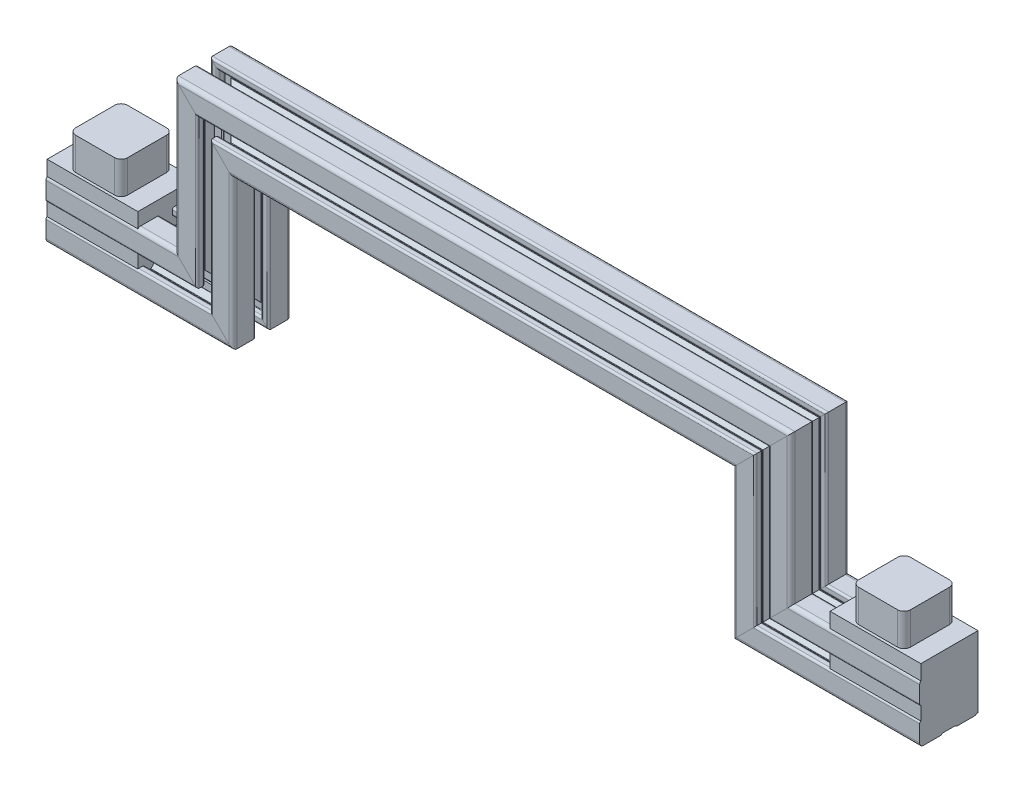
from build123d import *

# Parameters (mm, degrees)
SKETCH6_W            = 44.121320344
SKETCH6_H            = 54.791290411
BOSS_EXTRUDE3_DEPTH  = 70
SKETCH4_W            = 40
SKETCH4_H            = 40
RL_WHEEL_MOUNT_DEPTH = 25
FILLET1_R            = 5
FILLET1_OF_MIRROR1_R = 5


with BuildPart() as part:
    # Sweep1: sweep along a path in Sketch1
    with BuildLine(Plane.XY) as sweep1_path:
        Line((0, 0), (125, 0))
        Line((125, 0), (125, 115.07066992))
        Line((125, 115.07066992), (337, 115.07066992))
    # Sketch7 → Sweep1 (sweep)
    with BuildSketch(Plane(origin=(0, 0, 0), x_dir=(0, 0, -1), z_dir=(1, 0, 0))):
        with BuildLine():
            Line((4.905816029, 11.21531926), (4.005816103, 10.700171216))
            Line((4.005816103, 10.700171216), (3.105816176, 11.21531926))
            Line((3.105816176, 11.21531926), (-2.197508215, 11.21531926))
            ThreePointArc((-2.197508215, 11.21531926), (-2.342927919, 11.244245037), (-2.466208792, 11.326618683))
            Line((-2.466208792, 11.326618683), (-5.932884474, 14.793294365))
            ThreePointArc((-5.932884474, 14.793294365), (-6.01525812, 14.916575238), (-6.044183897, 15.061994942))
            Line((-6.044183897, 15.061994942), (-6.044183897, 19.35531926))
            ThreePointArc((-6.044183897, 19.35531926), (-5.932884474, 19.624019836), (-5.664183897, 19.73531926))
            Line((-5.664183897, 19.73531926), (-2.579183897, 19.73531926))
            ThreePointArc((-2.579183897, 19.73531926), (-1.50438159, 20.180516952), (-1.059183897, 21.25531926))
            Line((-1.059183897, 21.25531926), (-1.059183897, 24.21531926))
            ThreePointArc((-1.059183897, 24.21531926), (-1.50438159, 25.290121567), (-2.579183897, 25.73531926))
            Line((-2.579183897, 25.73531926), (-15.494183897, 25.73531926))
            ThreePointArc((-15.494183897, 25.73531926), (-17.615504241, 24.856639603), (-18.494183897, 22.73531926))
            Line((-18.494183897, 22.73531926), (-18.494183897, 9.82031926))
            ThreePointArc((-18.494183897, 9.82031926), (-18.048986205, 8.745516952), (-16.974183897, 8.30031926))
            Line((-16.974183897, 8.30031926), (-14.014183897, 8.30031926))
            ThreePointArc((-14.014183897, 8.30031926), (-12.93938159, 8.745516952), (-12.494183897, 9.82031926))
            Line((-12.494183897, 9.82031926), (-12.494183897, 12.90531926))
            ThreePointArc((-12.494183897, 12.90531926), (-12.382884474, 13.174019836), (-12.114183897, 13.28531926))
            Line((-12.114183897, 13.28531926), (-7.813788512, 13.28531926))
            ThreePointArc((-7.813788512, 13.28531926), (-7.668368808, 13.256393482), (-7.545087935, 13.174019836))
            Line((-7.545087935, 13.174019836), (-4.08548332, 9.714415222))
            ThreePointArc((-4.08548332, 9.714415222), (-4.003109675, 9.591134349), (-3.974183897, 9.445714645))
            Line((-3.974183897, 9.445714645), (-3.974183897, 4.135318895))
            Line((-3.974183897, 4.135318895), (-3.454570628, 3.23531926))
            Line((-3.454570628, 3.23531926), (-3.974183897, 2.335319624))
            Line((-3.974183897, 2.335319624), (-3.974183897, -2.968005058))
            ThreePointArc((-3.974183897, -2.968005058), (-4.003109675, -3.113424762), (-4.08548332, -3.236705635))
            Line((-4.08548332, -3.236705635), (-7.552159003, -6.703381317))
            ThreePointArc((-7.552159003, -6.703381317), (-7.675439876, -6.785754963), (-7.82085958, -6.81468074))
            Line((-7.82085958, -6.81468074), (-12.114183897, -6.81468074))
            ThreePointArc((-12.114183897, -6.81468074), (-12.382884474, -6.703381317), (-12.494183897, -6.43468074))
            Line((-12.494183897, -6.43468074), (-12.494183897, -3.34968074))
            ThreePointArc((-12.494183897, -3.34968074), (-12.93938159, -2.274878433), (-14.014183897, -1.82968074))
            Line((-14.014183897, -1.82968074), (-16.974183897, -1.82968074))
            ThreePointArc((-16.974183897, -1.82968074), (-18.048986205, -2.274878433), (-18.494183897, -3.34968074))
            Line((-18.494183897, -3.34968074), (-18.494183897, -16.26468074))
            ThreePointArc((-18.494183897, -16.26468074), (-17.615504241, -18.386001084), (-15.494183897, -19.26468074))
            Line((-15.494183897, -19.26468074), (-2.579183897, -19.26468074))
            ThreePointArc((-2.579183897, -19.26468074), (-1.50438159, -18.819483048), (-1.059183897, -17.74468074))
            Line((-1.059183897, -17.74468074), (-1.059183897, -14.78468074))
            ThreePointArc((-1.059183897, -14.78468074), (-1.50438159, -13.709878433), (-2.579183897, -13.26468074))
            Line((-2.579183897, -13.26468074), (-5.664183897, -13.26468074))
            ThreePointArc((-5.664183897, -13.26468074), (-5.932884474, -13.153381317), (-6.044183897, -12.88468074))
            Line((-6.044183897, -12.88468074), (-6.044183897, -8.584285355))
            ThreePointArc((-6.044183897, -8.584285355), (-6.01525812, -8.438865651), (-5.932884474, -8.315584778))
            Line((-5.932884474, -8.315584778), (-2.473279859, -4.855980164))
            ThreePointArc((-2.473279859, -4.855980164), (-2.349998987, -4.773606518), (-2.204579283, -4.74468074))
            Line((-2.204579283, -4.74468074), (3.105816176, -4.74468074))
            Line((3.105816176, -4.74468074), (4.005816103, -4.229532697))
            Line((4.005816103, -4.229532697), (4.905816029, -4.74468074))
            Line((4.905816029, -4.74468074), (10.20914042, -4.74468074))
            ThreePointArc((10.20914042, -4.74468074), (10.354560124, -4.773606518), (10.477840997, -4.855980164))
            Line((10.477840997, -4.855980164), (13.94451668, -8.322655846))
            ThreePointArc((13.94451668, -8.322655846), (14.026890325, -8.445936719), (14.055816103, -8.591356423))
            Line((14.055816103, -8.591356423), (14.055816103, -12.88468074))
            ThreePointArc((14.055816103, -12.88468074), (13.94451668, -13.153381317), (13.675816103, -13.26468074))
            Line((13.675816103, -13.26468074), (10.590816103, -13.26468074))
            ThreePointArc((10.590816103, -13.26468074), (9.516013795, -13.709878433), (9.070816103, -14.78468074))
            Line((9.070816103, -14.78468074), (9.070816103, -17.74468074))
            ThreePointArc((9.070816103, -17.74468074), (9.516013795, -18.819483048), (10.590816103, -19.26468074))
            Line((10.590816103, -19.26468074), (23.505816103, -19.26468074))
            ThreePointArc((23.505816103, -19.26468074), (25.627136446, -18.386001084), (26.505816103, -16.26468074))
            Line((26.505816103, -16.26468074), (26.505816103, -3.34968074))
            ThreePointArc((26.505816103, -3.34968074), (26.06061841, -2.274878433), (24.985816103, -1.82968074))
            Line((24.985816103, -1.82968074), (22.025816103, -1.82968074))
            ThreePointArc((22.025816103, -1.82968074), (20.951013795, -2.274878433), (20.505816103, -3.34968074))
            Line((20.505816103, -3.34968074), (20.505816103, -6.43468074))
            ThreePointArc((20.505816103, -6.43468074), (20.39451668, -6.703381317), (20.125816103, -6.81468074))
            Line((20.125816103, -6.81468074), (15.825420717, -6.81468074))
            ThreePointArc((15.825420717, -6.81468074), (15.680001013, -6.785754963), (15.556720141, -6.703381317))
            Line((15.556720141, -6.703381317), (12.097115526, -3.243776702))
            ThreePointArc((12.097115526, -3.243776702), (12.01474188, -3.12049583), (11.985816103, -2.975076126))
            Line((11.985816103, -2.975076126), (11.985816103, 2.335319624))
            Line((11.985816103, 2.335319624), (11.466202833, 3.23531926))
            Line((11.466202833, 3.23531926), (11.985816103, 4.135318895))
            Line((11.985816103, 4.135318895), (11.985816103, 9.438643577))
            ThreePointArc((11.985816103, 9.438643577), (12.01474188, 9.584063281), (12.097115526, 9.707344154))
            Line((12.097115526, 9.707344154), (15.563791208, 13.174019836))
            ThreePointArc((15.563791208, 13.174019836), (15.687072081, 13.256393482), (15.832491785, 13.28531926))
            Line((15.832491785, 13.28531926), (20.125816103, 13.28531926))
            ThreePointArc((20.125816103, 13.28531926), (20.39451668, 13.174019836), (20.505816103, 12.90531926))
            Line((20.505816103, 12.90531926), (20.505816103, 9.82031926))
            ThreePointArc((20.505816103, 9.82031926), (20.951013795, 8.745516952), (22.025816103, 8.30031926))
            Line((22.025816103, 8.30031926), (24.985816103, 8.30031926))
            ThreePointArc((24.985816103, 8.30031926), (26.06061841, 8.745516952), (26.505816103, 9.82031926))
            Line((26.505816103, 9.82031926), (26.505816103, 22.73531926))
            ThreePointArc((26.505816103, 22.73531926), (25.627136446, 24.856639603), (23.505816103, 25.73531926))
            Line((23.505816103, 25.73531926), (10.590816103, 25.73531926))
            ThreePointArc((10.590816103, 25.73531926), (9.516013795, 25.290121567), (9.070816103, 24.21531926))
            Line((9.070816103, 24.21531926), (9.070816103, 21.25531926))
            ThreePointArc((9.070816103, 21.25531926), (9.516013795, 20.180516952), (10.590816103, 19.73531926))
            Line((10.590816103, 19.73531926), (13.675816103, 19.73531926))
            ThreePointArc((13.675816103, 19.73531926), (13.94451668, 19.624019836), (14.055816103, 19.35531926))
            Line((14.055816103, 19.35531926), (14.055816103, 15.054923874))
            ThreePointArc((14.055816103, 15.054923874), (14.026890325, 14.90950417), (13.94451668, 14.786223298))
            Line((13.94451668, 14.786223298), (10.484912065, 11.326618683))
            ThreePointArc((10.484912065, 11.326618683), (10.361631192, 11.244245037), (10.216211488, 11.21531926))
            Line((10.216211488, 11.21531926), (4.905816029, 11.21531926))
        make_face()
        with BuildLine():
            Line((13.969837884, 21.274341041), (13.529837884, 21.274341041))
            ThreePointArc((13.529837884, 21.274341041), (12.469177713, 21.713680869), (12.029837884, 22.774341041))
            Line((12.029837884, 22.774341041), (12.029837884, 23.274341041))
            ThreePointArc((12.029837884, 23.274341041), (12.469177713, 24.335001213), (13.529837884, 24.774341041))
            Line((13.529837884, 24.774341041), (23.139837884, 24.774341041))
            ThreePointArc((23.139837884, 24.774341041), (24.752041345, 24.106544502), (25.419837884, 22.494341041))
            Line((25.419837884, 22.494341041), (25.419837884, 12.884341041))
            ThreePointArc((25.419837884, 12.884341041), (24.980498056, 11.823680869), (23.919837884, 11.384341041))
            Line((23.919837884, 11.384341041), (23.419837884, 11.384341041))
            ThreePointArc((23.419837884, 11.384341041), (22.359177713, 11.823680869), (21.919837884, 12.884341041))
            Line((21.919837884, 12.884341041), (21.919837884, 13.324341041))
            ThreePointArc((21.919837884, 13.324341041), (21.626944666, 14.031447822), (20.919837884, 14.324341041))
            Line((20.919837884, 14.324341041), (15.349837884, 14.324341041))
            ThreePointArc((15.349837884, 14.324341041), (15.081137307, 14.435640464), (14.969837884, 14.704341041))
            Line((14.969837884, 14.704341041), (14.969837884, 20.274341041))
            ThreePointArc((14.969837884, 20.274341041), (14.676944666, 20.981447822), (13.969837884, 21.274341041))
        make_face(mode=Mode.SUBTRACT)
        with BuildLine():
            Line((21.958859666, -6.68968074), (21.958859666, -6.24968074))
            ThreePointArc((21.958859666, -6.24968074), (22.398199494, -5.189020569), (23.458859666, -4.74968074))
            Line((23.458859666, -4.74968074), (23.958859666, -4.74968074))
            ThreePointArc((23.958859666, -4.74968074), (25.019519838, -5.189020569), (25.458859666, -6.24968074))
            Line((25.458859666, -6.24968074), (25.458859666, -15.85968074))
            ThreePointArc((25.458859666, -15.85968074), (24.791063127, -17.471884201), (23.178859666, -18.13968074))
            Line((23.178859666, -18.13968074), (13.568859666, -18.13968074))
            ThreePointArc((13.568859666, -18.13968074), (12.508199494, -17.700340912), (12.068859666, -16.63968074))
            Line((12.068859666, -16.63968074), (12.068859666, -16.13968074))
            ThreePointArc((12.068859666, -16.13968074), (12.508199494, -15.079020569), (13.568859666, -14.63968074))
            Line((13.568859666, -14.63968074), (14.008859666, -14.63968074))
            ThreePointArc((14.008859666, -14.63968074), (14.715966447, -14.346787522), (15.008859666, -13.63968074))
            Line((15.008859666, -13.63968074), (15.008859666, -8.06968074))
            ThreePointArc((15.008859666, -8.06968074), (15.120159089, -7.800980164), (15.388859666, -7.68968074))
            Line((15.388859666, -7.68968074), (20.958859666, -7.68968074))
            ThreePointArc((20.958859666, -7.68968074), (21.665966447, -7.396787522), (21.958859666, -6.68968074))
        make_face(mode=Mode.SUBTRACT)
        with BuildLine():
            Line((-6.005162116, -14.678702522), (-5.565162116, -14.678702522))
            ThreePointArc((-5.565162116, -14.678702522), (-4.504501944, -15.11804235), (-4.065162116, -16.178702522))
            Line((-4.065162116, -16.178702522), (-4.065162116, -16.678702522))
            ThreePointArc((-4.065162116, -16.678702522), (-4.504501944, -17.739362694), (-5.565162116, -18.178702522))
            Line((-5.565162116, -18.178702522), (-15.175162116, -18.178702522))
            ThreePointArc((-15.175162116, -18.178702522), (-16.787365577, -17.510905983), (-17.455162116, -15.898702522))
            Line((-17.455162116, -15.898702522), (-17.455162116, -6.288702522))
            ThreePointArc((-17.455162116, -6.288702522), (-17.015822287, -5.22804235), (-15.955162116, -4.788702522))
            Line((-15.955162116, -4.788702522), (-15.455162116, -4.788702522))
            ThreePointArc((-15.455162116, -4.788702522), (-14.394501944, -5.22804235), (-13.955162116, -6.288702522))
            Line((-13.955162116, -6.288702522), (-13.955162116, -6.728702522))
            ThreePointArc((-13.955162116, -6.728702522), (-13.662268897, -7.435809303), (-12.955162116, -7.728702522))
            Line((-12.955162116, -7.728702522), (-7.385162116, -7.728702522))
            ThreePointArc((-7.385162116, -7.728702522), (-7.116461539, -7.840001945), (-7.005162116, -8.108702522))
            Line((-7.005162116, -8.108702522), (-7.005162116, -13.678702522))
            ThreePointArc((-7.005162116, -13.678702522), (-6.712268897, -14.385809303), (-6.005162116, -14.678702522))
        make_face(mode=Mode.SUBTRACT)
        with BuildLine():
            Line((1.828915922, -2.488564034), (1.413170132, -2.316356489))
            ThreePointArc((1.413170132, -2.316356489), (0.823336155, -1.625307126), (1.036269925, -0.742067321))
            ThreePointArc((1.036269925, -0.742067321), (0.446703204, -0.237613869), (-0.057716637, 0.351981608))
            ThreePointArc((-0.057716637, 0.351981608), (-0.940937171, 0.139101897), (-1.631952253, 0.728927667))
            Line((-1.631952253, 0.728927667), (-1.804159798, 1.144673456))
            ThreePointArc((-1.804159798, 1.144673456), (-1.732589712, 2.050394753), (-0.957477943, 2.524372695))
            ThreePointArc((-0.957477943, 2.524372695), (-1.017662114, 3.297961778), (-0.957433843, 4.071547428))
            ThreePointArc((-0.957433843, 4.071547428), (-1.73249376, 4.54554997), (-1.804045409, 5.451241222))
            Line((-1.804045409, 5.451241222), (-1.631837865, 5.866987012))
            ThreePointArc((-1.631837865, 5.866987012), (-0.940788501, 6.456820989), (-0.057548696, 6.243887219))
            ThreePointArc((-0.057548696, 6.243887219), (0.446904755, 6.83345394), (1.036500233, 7.33787378))
            ThreePointArc((1.036500233, 7.33787378), (0.823620522, 8.221094315), (1.413446291, 8.912109397))
            Line((1.413446291, 8.912109397), (1.829192081, 9.084316942))
            ThreePointArc((1.829192081, 9.084316942), (2.734913377, 9.012746856), (3.20889132, 8.237635087))
            ThreePointArc((3.20889132, 8.237635087), (3.982480402, 8.297819258), (4.756066053, 8.237590987))
            ThreePointArc((4.756066053, 8.237590987), (5.230068594, 9.012650904), (6.135759847, 9.084202553))
            Line((6.135759847, 9.084202553), (6.551505636, 8.911995008))
            ThreePointArc((6.551505636, 8.911995008), (7.141339614, 8.220945645), (6.928405843, 7.33770584))
            ThreePointArc((6.928405843, 7.33770584), (7.517972564, 6.833252389), (8.022392405, 6.243656911))
            ThreePointArc((8.022392405, 6.243656911), (8.905612939, 6.456536622), (9.596628022, 5.866710852))
            Line((9.596628022, 5.866710852), (9.768835567, 5.450965063))
            ThreePointArc((9.768835567, 5.450965063), (9.697265481, 4.545243766), (8.922153712, 4.071265824))
            ThreePointArc((8.922153712, 4.071265824), (8.982337882, 3.297676741), (8.922109612, 2.524091091))
            ThreePointArc((8.922109612, 2.524091091), (9.697169528, 2.05008855), (9.768721178, 1.144397297))
            Line((9.768721178, 1.144397297), (9.596513633, 0.728651507))
            ThreePointArc((9.596513633, 0.728651507), (8.90546427, 0.13881753), (8.022224464, 0.351751301))
            ThreePointArc((8.022224464, 0.351751301), (7.517771013, -0.23781542), (6.928175536, -0.742235261))
            ThreePointArc((6.928175536, -0.742235261), (7.141055247, -1.625455795), (6.551229477, -2.316470878))
            Line((6.551229477, -2.316470878), (6.135483688, -2.488678423))
            ThreePointArc((6.135483688, -2.488678423), (5.229762391, -2.417108337), (4.755784449, -1.641996568))
            ThreePointArc((4.755784449, -1.641996568), (3.982195366, -1.702180738), (3.208609716, -1.641952468))
            ThreePointArc((3.208609716, -1.641952468), (2.734607174, -2.417012384), (1.828915922, -2.488564034))
        make_face(mode=Mode.SUBTRACT)
        with BuildLine():
            Line((-13.994183897, 13.28531926), (-13.994183897, 12.84531926))
            ThreePointArc((-13.994183897, 12.84531926), (-14.433523726, 11.784659088), (-15.494183897, 11.34531926))
            Line((-15.494183897, 11.34531926), (-15.994183897, 11.34531926))
            ThreePointArc((-15.994183897, 11.34531926), (-17.054844069, 11.784659088), (-17.494183897, 12.84531926))
            Line((-17.494183897, 12.84531926), (-17.494183897, 22.45531926))
            ThreePointArc((-17.494183897, 22.45531926), (-16.826387358, 24.067522721), (-15.214183897, 24.73531926))
            Line((-15.214183897, 24.73531926), (-5.604183897, 24.73531926))
            ThreePointArc((-5.604183897, 24.73531926), (-4.543523726, 24.295979431), (-4.104183897, 23.23531926))
            Line((-4.104183897, 23.23531926), (-4.104183897, 22.73531926))
            ThreePointArc((-4.104183897, 22.73531926), (-4.543523726, 21.674659088), (-5.604183897, 21.23531926))
            Line((-5.604183897, 21.23531926), (-6.044183897, 21.23531926))
            ThreePointArc((-6.044183897, 21.23531926), (-6.751290679, 20.942426041), (-7.044183897, 20.23531926))
            Line((-7.044183897, 20.23531926), (-7.044183897, 14.66531926))
            ThreePointArc((-7.044183897, 14.66531926), (-7.15548332, 14.396618683), (-7.424183897, 14.28531926))
            Line((-7.424183897, 14.28531926), (-12.994183897, 14.28531926))
            ThreePointArc((-12.994183897, 14.28531926), (-13.701290679, 13.992426041), (-13.994183897, 13.28531926))
        make_face(mode=Mode.SUBTRACT)
    sweep1 = sweep(path=sweep1_path.line, transition=Transition.RIGHT)

    # Sketch6 → Boss-Extrude3 (add)
    with BuildSketch(Plane.ZY):
        with Locations((-4.445155931, 9.009644122)):
            Rectangle(SKETCH6_W, SKETCH6_H)
    boss_extrude3 = extrude(amount=-BOSS_EXTRUDE3_DEPTH)

    # Sketch4 → RL Wheel Mount (add)
    with BuildSketch(Plane(origin=(0, 36.405289327, 0), x_dir=(1, 0, 0), z_dir=(0, 1, 0))):
        with Locations((35, 4.445155931)):
            Rectangle(SKETCH4_W, SKETCH4_H)
    rl_wheel_mount = extrude(amount=RL_WHEEL_MOUNT_DEPTH)

    # Fillet1
    fillet1_edges = [part.edges().sort_by_distance(p)[0] for p in [
        (15, 48.905289327, -24.445155931),
        (55, 48.905289327, -24.445155931),
        (55, 48.905289327, 15.554844069),
        (15, 48.905289327, 15.554844069),
    ]]
    fillet(fillet1_edges, radius=FILLET1_R)

    # Mirror1: Sweep1, Boss-Extrude3, RL Wheel Mount across plane
    add(sweep1.mirror(Plane(origin=(337, 0, 0), x_dir=(0, 0, 1), z_dir=(1, 0, 0))))
    add(boss_extrude3.mirror(Plane(origin=(337, 0, 0), x_dir=(0, 0, 1), z_dir=(1, 0, 0))))
    add(rl_wheel_mount.mirror(Plane(origin=(337, 0, 0), x_dir=(0, 0, 1), z_dir=(1, 0, 0))))

    # Fillet1 of Mirror1
    fillet1_of_mirror1_edges = [part.edges().sort_by_distance(p)[0] for p in [
        (659, 48.905289327, -24.445155931),
        (619, 48.905289327, -24.445155931),
        (619, 48.905289327, 15.554844069),
        (659, 48.905289327, 15.554844069),
    ]]
    fillet(fillet1_of_mirror1_edges, radius=FILLET1_OF_MIRROR1_R)


solid = part.part
